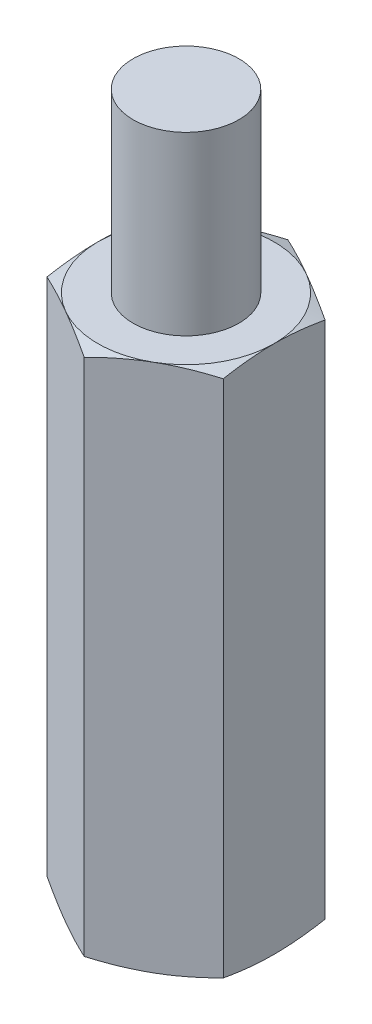
from build123d import *

# Parameters (mm, degrees)
SKETCH1_R           = 1.5
BOSS_EXTRUDE1_DEPTH = 15
SKETCH7_R           = 1.5
BOSS_EXTRUDE2_DEPTH = 5


with BuildPart() as part:
    # Sketch1 → Boss-Extrude1 (new body)
    with BuildSketch(Plane(origin=(0, 0, 0), x_dir=(1, 0, 0), z_dir=(0, 1, 0))):
        Polygon((0, 2.886751346), (-2.5, 1.443375673), (-2.5, -1.443375673), (0, -2.886751346), (2.5, -1.443375673), (2.5, 1.443375673), align=None)
        Circle(SKETCH1_R, mode=Mode.SUBTRACT)
    extrude(amount=BOSS_EXTRUDE1_DEPTH)

    # Sketch6 → Cut-Revolve1 (revolve, cut)
    with BuildSketch(Plane.ZY):
        Polygon((2.5, 15), (2.886751346, 15), (2.886751346, 14.859234022), align=None)
    cut_revolve1 = revolve(axis=Axis((0, 15, 0), (0, 1, 0)), mode=Mode.SUBTRACT)

    # Mirror1: Cut-Revolve1 across plane
    add(cut_revolve1.mirror(Plane.ZX.offset(7.5)), mode=Mode.SUBTRACT)


with BuildPart() as body_2:
    # Sketch7 → Boss-Extrude2 (new body)
    with BuildSketch(Plane(origin=(0, 15, 0), x_dir=(1, 0, 0), z_dir=(0, 1, 0))):
        Circle(SKETCH7_R)
    extrude(amount=BOSS_EXTRUDE2_DEPTH)


solid = Compound([part.part, body_2.part])
